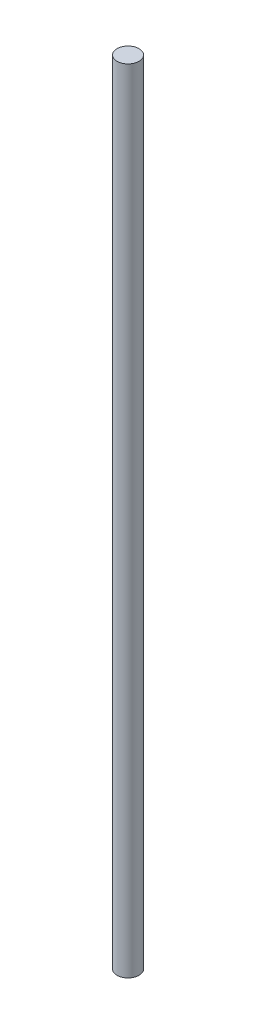
from build123d import *

# Parameters (mm, degrees)
SKETCH_1_R      = 2.5
EXTRUDE_1_DEPTH = 180


with BuildPart() as part:
    # Эскиз1 → Бобышка-Вытянуть1 (new body)
    with BuildSketch(Plane(origin=(0, 0, 0), x_dir=(1, 0, 0), z_dir=(0, 1, 0))):
        Circle(SKETCH_1_R)
    extrude(amount=EXTRUDE_1_DEPTH)


solid = part.part
